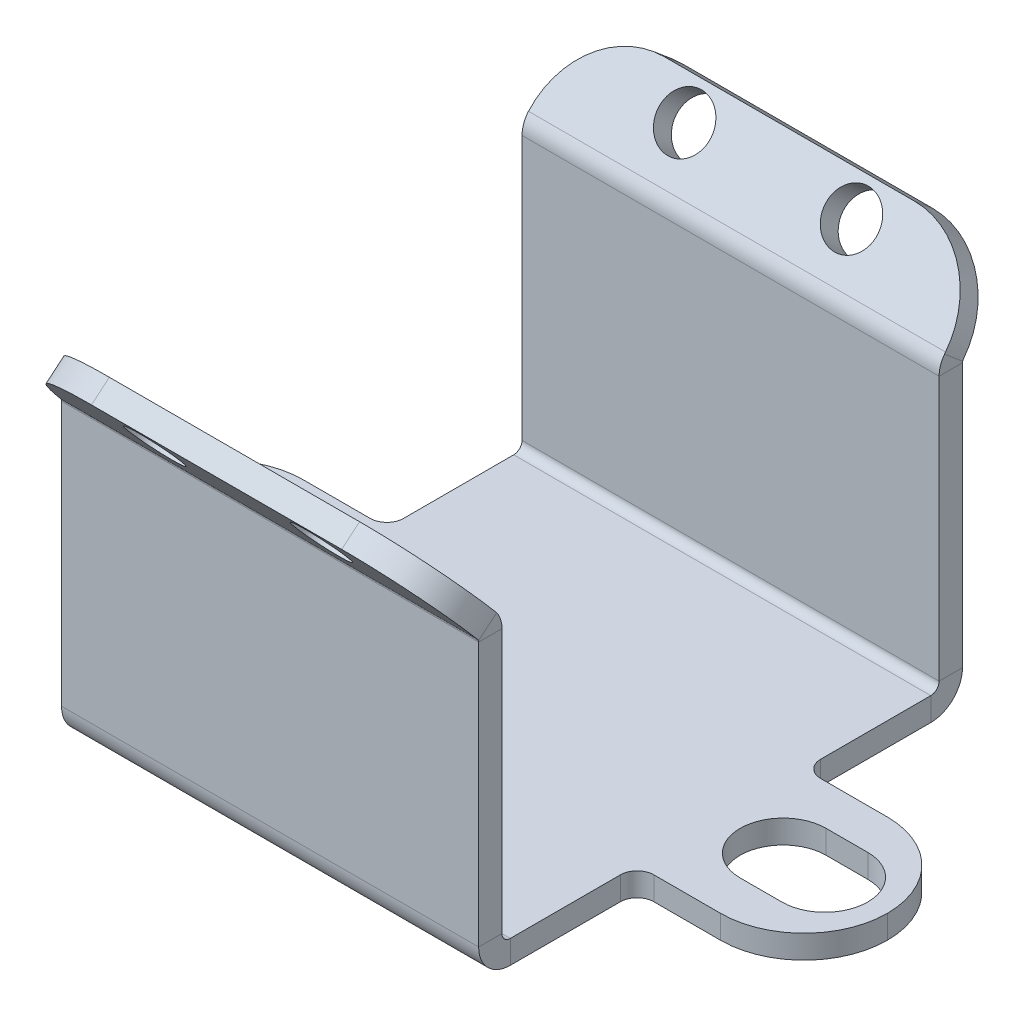
from build123d import *

# Parameters (mm, degrees)
SKETCH1_R                      = 5.1
BASE_FLANGE1_DEPTH             = 2.8
EDGE_FLANGE1_STRIP_W           = 13.2
EDGE_FLANGE1_STRIP_H           = 2.8
EDGE_FLANGE1_STRIP_CUT_DEPTH   = 50
EDGE_FLANGE1_STRIP_2_W         = 13.2
EDGE_FLANGE1_STRIP_2_H         = 2.8
EDGE_FLANGE1_STRIP_CUT_2_DEPTH = 50
EDGE_FLANGE1_DEPTH             = 50
EDGE_FLANGE1_BEND_DEPTH        = 50
EDGE_FLANGE2_START             = -25
EDGE_FLANGE2_DEPTH             = 50
EDGE_FLANGE2_2_DEPTH           = 50
SKETCH20_R                     = 3.15
CUT_EXTRUDE1_DEPTH             = 72.206525832
FILLET1_R                      = 10
FILLET2_R                      = 2


# Read off the part's stored shape, not the designer's step: Edge-Flange2
# Sheet-metal steps are written as plain solids
with BuildPart() as part:
    # Sketch1 → Base-Flange1 (new body)
    with BuildSketch(Plane(origin=(0, 0, 0), x_dir=(1, 0, 0), z_dir=(0, 1, 0))):
        Polygon((-25, 29), (25, 29), (25, 10), (45, 10), (45, -10), (25, -10), (25, -29), (-25, -29), (-25, -10), (-45, -10), (-45, 10), (-25, 10), align=None)
        with Locations(Location((-35, 0, 0), (0, 0, 270))):
            Circle(SKETCH1_R, mode=Mode.SUBTRACT)
        with BuildLine():
            Line((32.5, 5.15), (37.5, 5.15))
            ThreePointArc((37.5, 5.15), (42.65, 0), (37.5, -5.15))
            Line((37.5, -5.15), (32.5, -5.15))
            ThreePointArc((32.5, -5.15), (27.35, 0), (32.5, 5.15))
        make_face(mode=Mode.SUBTRACT)
    extrude(amount=-BASE_FLANGE1_DEPTH)

    # Edge-Flange1 strip (across the edge) → Edge-Flange1 strip cut (cut)
    with BuildSketch(Plane(origin=(25, 0, -29), x_dir=(0, 0, 1), z_dir=(-1, 0, 0))):
        with Locations((-2.8, -1.4)):
            Rectangle(EDGE_FLANGE1_STRIP_W, EDGE_FLANGE1_STRIP_H)
    extrude(amount=EDGE_FLANGE1_STRIP_CUT_DEPTH, mode=Mode.SUBTRACT)

    # Edge-Flange1 strip 2 (across the edge) → Edge-Flange1 strip cut 2 (cut)
    with BuildSketch(Plane(origin=(-25, 0, 29), x_dir=(0, 0, -1), z_dir=(1, 0, 0))):
        with Locations((-2.8, -1.4)):
            Rectangle(EDGE_FLANGE1_STRIP_2_W, EDGE_FLANGE1_STRIP_2_H)
    extrude(amount=EDGE_FLANGE1_STRIP_CUT_2_DEPTH, mode=Mode.SUBTRACT)

    # Edge-Flange1 section (across the edge) → Edge-Flange1 (add)
    with BuildSketch(Plane(origin=(25, 0, -29), x_dir=(0, 0, 1), z_dir=(-1, 0, 0))):
        with BuildLine():
            Line((0, 1), (0, 37.2))
            Line((0, 37.2), (2.8, 37.2))
            Line((2.8, 37.2), (2.8, 1))
            ThreePointArc((2.8, 1), (3.092893219, 0.292893219), (3.8, 0))
            Line((3.8, 0), (3.8, -2.8))
            ThreePointArc((3.8, -2.8), (1.112994231, -1.687005769), (0, 1))
        make_face()
    extrude(amount=EDGE_FLANGE1_DEPTH)

    # Edge-Flange1 section 2 (across the edge) → Edge-Flange1 bend (add)
    with BuildSketch(Plane(origin=(-25, 0, 29), x_dir=(0, 0, -1), z_dir=(1, 0, 0))):
        with BuildLine():
            Line((0, 1), (0, 37.2))
            Line((0, 37.2), (2.8, 37.2))
            Line((2.8, 37.2), (2.8, 1))
            ThreePointArc((2.8, 1), (3.092893219, 0.292893219), (3.8, 0))
            Line((3.8, 0), (3.8, -2.8))
            ThreePointArc((3.8, -2.8), (1.112994231, -1.687005769), (0, 1))
        make_face()
    extrude(amount=EDGE_FLANGE1_BEND_DEPTH)

    # Edge-Flange2 outline → Edge-Flange2 (cut)
    with BuildSketch(Plane.YZ.offset(EDGE_FLANGE2_START)):
        with BuildLine():
            ThreePointArc((32.661988168, -26.2), (33.790654641, -26.399014351), (34.78318728, -26.972053338))
            Line((34.78318728, -26.972053338), (37.2, -29))
            Line((37.2, -29), (37.2, -26.2))
            Line((37.2, -26.2), (32.661988168, -26.2))
        make_face()
        with BuildLine():
            Line((37.2, 29), (34.78318728, 26.972053338))
            ThreePointArc((34.78318728, 26.972053338), (33.790654641, 26.399014351), (32.661988168, 26.2))
            Line((32.661988168, 26.2), (37.2, 26.2))
            Line((37.2, 26.2), (37.2, 29))
        make_face()
    extrude(amount=EDGE_FLANGE2_DEPTH, mode=Mode.SUBTRACT)

    # Edge-Flange2 2 outline → Edge-Flange2 2 (add)
    with BuildSketch(Plane.YZ.offset(EDGE_FLANGE2_START)):
        with BuildLine():
            Line((42.289578815, -33.270663707), (37.2, -29))
            Line((37.2, -29), (32.661988168, -29))
            ThreePointArc((32.661988168, -29), (32.832998239, -29.03015369), (32.983381973, -29.116977778))
            Line((32.983381973, -29.116977778), (40.489773508, -35.415588147))
            Line((40.489773508, -35.415588147), (42.289578815, -33.270663707))
        make_face()
        with BuildLine():
            Line((32.661988168, 29), (37.2, 29))
            Line((37.2, 29), (42.289578815, 33.270663707))
            Line((42.289578815, 33.270663707), (40.489773508, 35.415588147))
            Line((40.489773508, 35.415588147), (32.983381973, 29.116977778))
            ThreePointArc((32.983381973, 29.116977778), (32.832998239, 29.03015369), (32.661988168, 29))
        make_face()
    extrude(amount=EDGE_FLANGE2_2_DEPTH)

    # Sketch20 → Cut-Extrude1 (cut, through all)
    with BuildSketch(Plane(origin=(0, 1.090431477, 1.29952563), x_dir=(1, 0, 0), z_dir=(0, 0.642787609686538, 0.7660444431189792))):
        with Locations(Location((-10, 49.78166725, 0), (0, 0, 270))):
            Circle(SKETCH20_R)
        with Locations(Location((10, 49.78166725, 0), (0, 0, 270))):
            Circle(SKETCH20_R)
    cut_extrude1 = extrude(amount=-CUT_EXTRUDE1_DEPTH, mode=Mode.SUBTRACT)

    # Mirror2: Cut-Extrude1 across plane
    add(cut_extrude1.mirror(Plane.XY), mode=Mode.SUBTRACT)

    # Fillet1
    # the kernel refuses this fillet: 10 mm, written as the material it takes off along each edge
    with BuildSketch(Plane(origin=(45, 25, -10), x_dir=(0, 0, 1), z_dir=(0, -1, 0)), Plane(origin=(45, 25, 10), x_dir=(-1, 0, 0), z_dir=(0, -1, 0)), Plane(origin=(-45, 25, -10), x_dir=(1, 0, 0), z_dir=(0, -1, 0)), Plane(origin=(-45, 25, 10), x_dir=(0, 0, -1), z_dir=(0, -1, 0))) as fillet1_piece_1:
        with BuildLine():
            CenterArc((FILLET1_R, FILLET1_R), FILLET1_R, 180, 90)
            Line((0, FILLET1_R), (0, 0))
            Line((0, 0), (FILLET1_R, 0))
        make_face()
    extrude(amount=52.8, mode=Mode.SUBTRACT)
    with BuildSketch(Plane(origin=(-25, 58.35926906, 14.119552631), x_dir=(0, -0.7660444430323039, -0.6427876097898334), z_dir=(0, -0.6427876097898335, 0.766044443032304)), Plane(origin=(25, 24.420083263, -54.566699223), x_dir=(-1, 0, 0), z_dir=(0, 0.6427876097898335, 0.766044443032304)), Plane(origin=(-25, 24.420083263, -54.566699223), x_dir=(0, -0.7660444430323039, 0.6427876097898334), z_dir=(0, 0.6427876097898335, 0.766044443032304))) as fillet1_piece_2:
        with BuildLine():
            CenterArc((FILLET1_R, FILLET1_R), FILLET1_R, 180, 90)
            Line((0, FILLET1_R), (0, 0))
            Line((0, 0), (FILLET1_R, 0))
        make_face()
    extrude(amount=52.799999999, mode=Mode.SUBTRACT)
    with BuildSketch(Plane(origin=(25, 58.35926906, 14.119552631), x_dir=(0, -0.766044443032304, -0.6427876097898335), z_dir=(0, -0.6427876097898335, 0.766044443032304))) as fillet1_piece_3:
        with BuildLine():
            CenterArc((FILLET1_R, -FILLET1_R), FILLET1_R, 90, 90)
            Line((0, -FILLET1_R), (0, 0))
            Line((0, 0), (FILLET1_R, 0))
        make_face()
    extrude(amount=52.799999999, mode=Mode.SUBTRACT)

    # Fillet2
    fillet2_edges = [part.edges().sort_by_distance(p)[0] for p in [
        (-25, -1.4, 10),
        (-25, -1.4, -10),
        (25, -1.4, -10),
        (25, -1.4, 10),
    ]]
    fillet(fillet2_edges, radius=FILLET2_R)


solid = part.part
